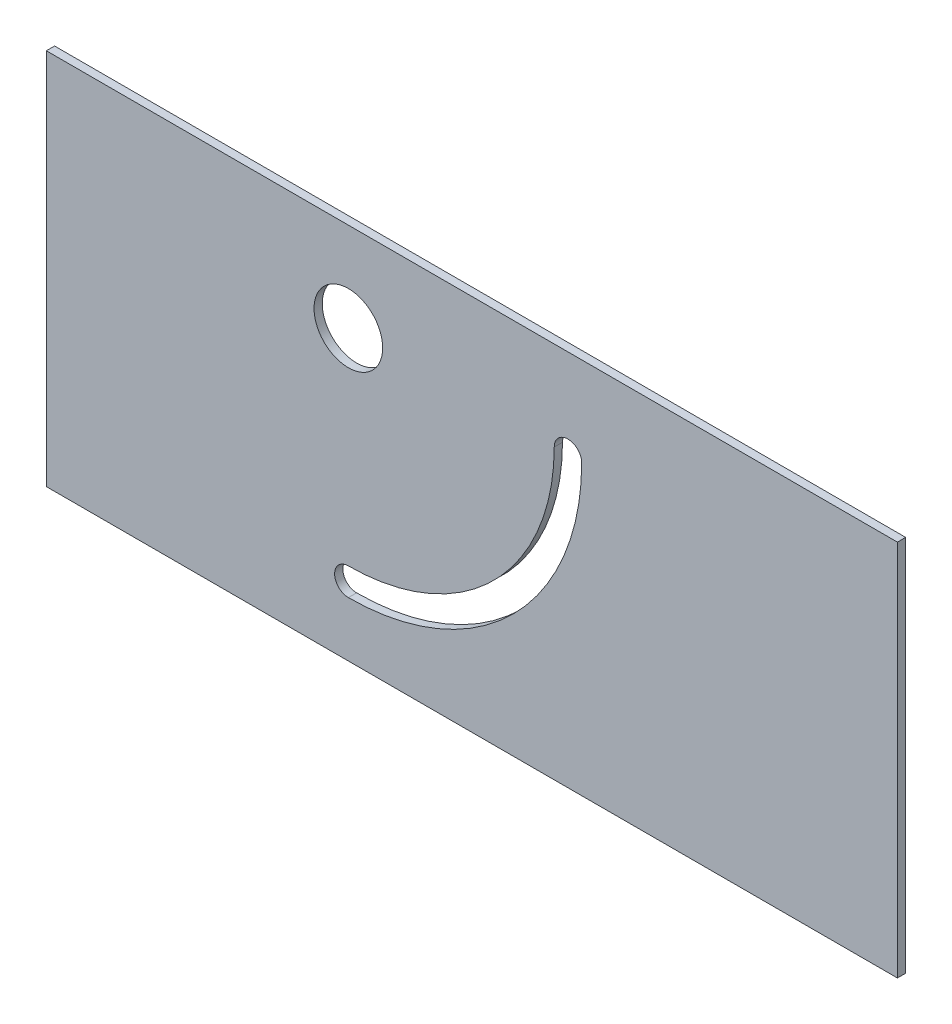
from build123d import *

# Parameters (mm, degrees)
SKETCH1_W           = 310
SKETCH1_H           = 137.5
SKETCH1_R           = 12.5
BOSS_EXTRUDE1_DEPTH = 3


with BuildPart() as part:
    # Sketch1 → Boss-Extrude1 (new body)
    with BuildSketch(Plane.XY):
        with Locations((129.5, 68.75)):
            Rectangle(SKETCH1_W, SKETCH1_H)
        with Locations((84.5, 105)):
            Circle(SKETCH1_R, mode=Mode.SUBTRACT)
        with BuildLine():
            ThreePointArc((169.5, 105), (164.5, 110), (159.5, 105))
            ThreePointArc((159.5, 105), (137.533008589, 51.966991411), (84.5, 30))
            ThreePointArc((84.5, 30), (79.5, 25), (84.5, 20))
            ThreePointArc((84.5, 20), (144.604076401, 44.895923599), (169.5, 105))
        make_face(mode=Mode.SUBTRACT)
    extrude(amount=BOSS_EXTRUDE1_DEPTH)


solid = part.part
